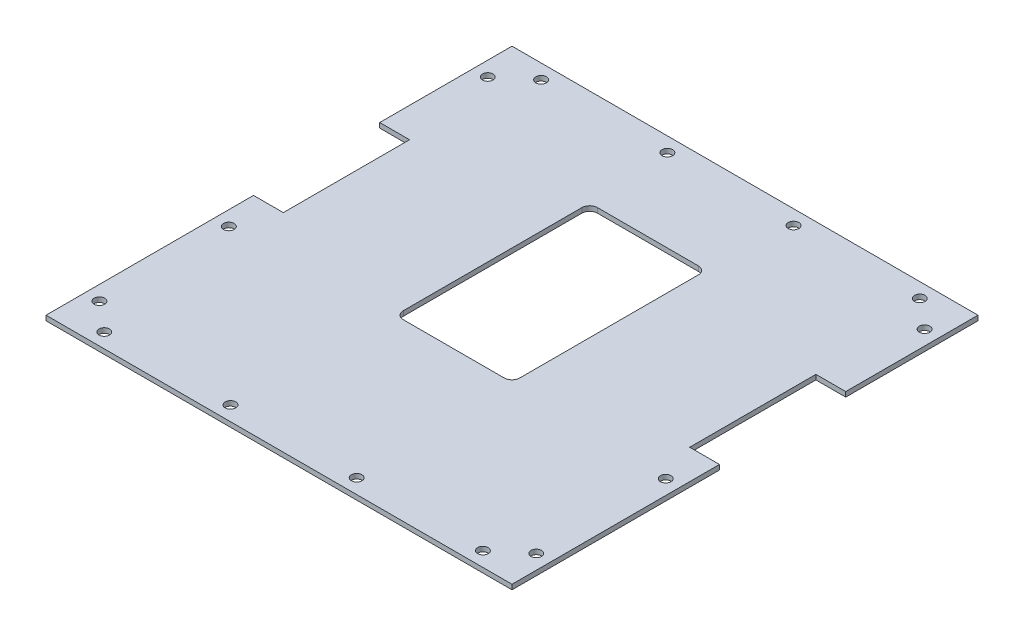
from build123d import *

# Parameters (mm, degrees)
SKETCH2_W             = 152.4
SKETCH2_H             = 152.4
BOSS_EXTRUDE1_DEPTH   = 1.5875
F_5_CLEARANCE_HOLE2_D = 3.4544
F_5_CLEARANCE_HOLE3_D = 3.4544
LPATTERN1_COUNT       = 4
LPATTERN1_PITCH       = 42.333333333
LPATTERN2_COUNT       = 4
LPATTERN2_PITCH       = 41.275
SKETCH12_W            = 38.1
SKETCH12_H            = 63.5
CUT_EXTRUDE1_DEPTH    = 2.54
FILLET2_R             = 2.54
SKETCH13_W            = 9.75
SKETCH13_H            = 41.28
CUT_EXTRUDE2_DEPTH    = 216.531993347


with BuildPart() as part:
    # Sketch2 → Boss-Extrude1 (new body)
    with BuildSketch(Plane(origin=(0, 0, 0), x_dir=(1, 0, 0), z_dir=(0, 1, 0))):
        with Locations((76.2, 76.2)):
            Rectangle(SKETCH2_W, SKETCH2_H)
    extrude(amount=BOSS_EXTRUDE1_DEPTH)

    # #5 Clearance Hole2 (through all)
    with Locations(Plane(origin=(0, 1.5875, 0), x_dir=(1, 0, 0), z_dir=(0, 1, 0))):
        with Locations((14.2875, 147.6375), (14.2875, 4.7625)):
            f_5_clearance_hole2 = Hole(F_5_CLEARANCE_HOLE2_D / 2)

    # #5 Clearance Hole3 (through all)
    with Locations(Plane(origin=(0, 1.5875, 0), x_dir=(1, 0, 0), z_dir=(0, 1, 0))):
        with Locations((4.7625, 139.7), (147.6375, 139.7)):
            f_5_clearance_hole3 = Hole(F_5_CLEARANCE_HOLE3_D / 2)

    # LPattern1: #5 Clearance Hole3 ×4, 1 skipped
    with Locations(*[(0, 0, i * LPATTERN1_PITCH) for i in range(1, LPATTERN1_COUNT) if i not in (1,)]):
        add(f_5_clearance_hole3, mode=Mode.SUBTRACT)

    # LPattern2: #5 Clearance Hole2 ×4
    with Locations(*[(i * LPATTERN2_PITCH, 0, 0) for i in range(1, LPATTERN2_COUNT)]):
        add(f_5_clearance_hole2, mode=Mode.SUBTRACT)

    # Sketch12 → Cut-Extrude1 (cut)
    with BuildSketch(Plane(origin=(0, 1.5875, 0), x_dir=(1, 0, 0), z_dir=(0, 1, 0))):
        with Locations((76.2, 88.9)):
            Rectangle(SKETCH12_W, SKETCH12_H)
    extrude(amount=-CUT_EXTRUDE1_DEPTH, mode=Mode.SUBTRACT)

    # Fillet2
    fillet2_edges = [part.edges().sort_by_distance(p)[0] for p in [
        (95.25, 0.79375, -57.15),
        (57.15, 0.79375, -57.15),
        (57.15, 0.79375, -120.65),
        (95.25, 0.79375, -120.65),
    ]]
    fillet(fillet2_edges, radius=FILLET2_R)

    # Sketch13 → Cut-Extrude2 (cut, through all)
    with BuildSketch(Plane(origin=(0, 1.5875, 0), x_dir=(1, 0, 0), z_dir=(0, 1, 0))):
        with Locations((147.525, 88.5)):
            Rectangle(SKETCH13_W, SKETCH13_H)
        with Locations((4.875, 88.5)):
            Rectangle(SKETCH13_W, SKETCH13_H)
    extrude(amount=-CUT_EXTRUDE2_DEPTH, mode=Mode.SUBTRACT)


solid = part.part
